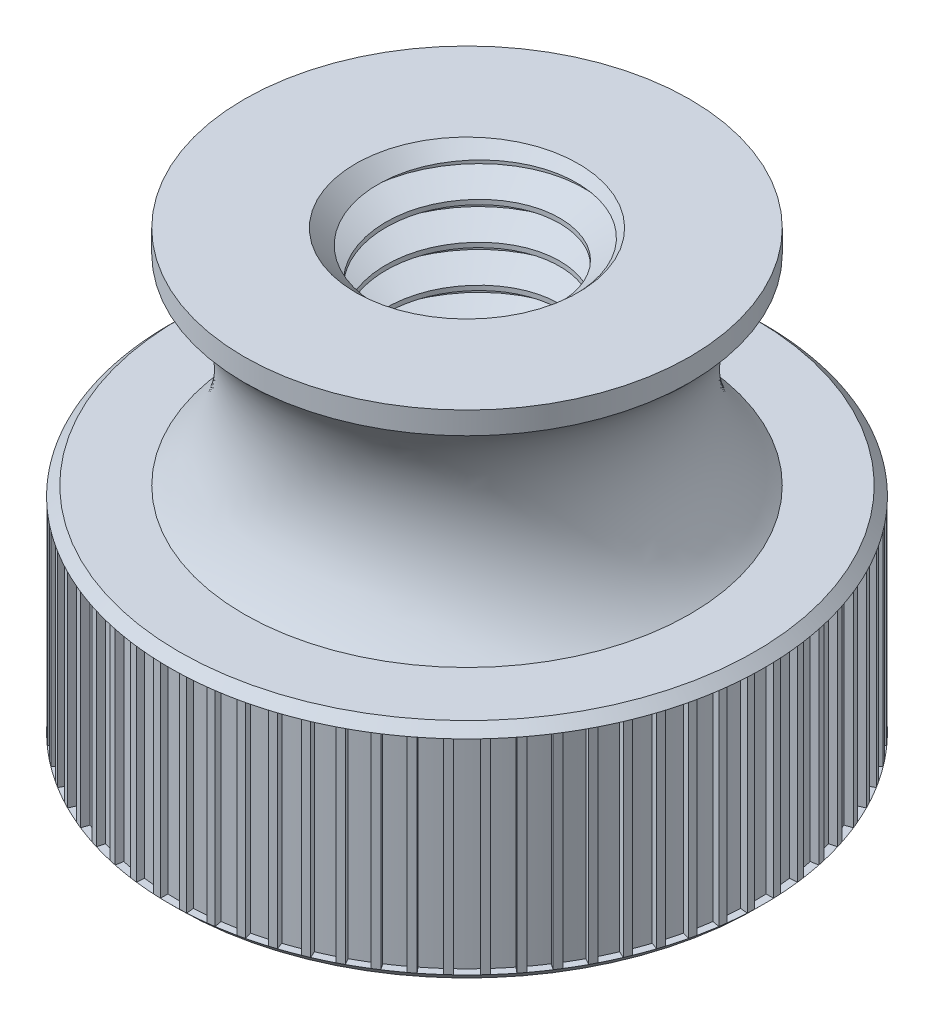
from build123d import *

# Parameters (mm, degrees)
SKETCH3_R               = 1.5
CUT_EXTRUDE1_DEPTH      = 9.246211251
SWEEP1_PITCH            = 0.5
SKETCH13_R              = 4
CUT_EXTRUDE2_DEPTH      = 11.630292617
SKETCH14_R              = 4
CUT_EXTRUDE3_DEPTH      = 9.246211421
CHAMFER1_SIZE           = 0.125
CUT_EXTRUDE6_REACH      = 20.19
CUT_EXTRUDE6_END_RADIUS = 4
SKETCH17_W              = 0.254
SKETCH17_H              = 2.75
CIRPATTERN1_COUNT       = 72


with BuildPart() as part:
    # Sketch1 → Revolve1 (revolve)
    with BuildSketch(Plane.XY, mode=Mode.PRIVATE) as revolve1_sk:
        with BuildLine():
            Line((0, 6), (-3, 6))
            Line((-3, 6), (-3, 5.7))
            ThreePointArc((-3, 5.7), (-2.4, 4.35), (-3, 3))
            Line((-3, 3), (-4, 3))
            Line((-4, 3), (-4, 0))
            Line((-4, 0), (0, 0))
            Line((0, 0), (0, 6))
        make_face()
    revolve(revolve1_sk.sketch.rotate(Axis((0, 0, 0), (0, 1, 0)), 270), axis=Axis((0, 0, 0), (0, 1, 0)))

    # Sketch3 → Cut-Extrude1 (cut, through all)
    with BuildSketch(Plane(origin=(0, 0, 0), x_dir=(1, 0, 0), z_dir=(0, 1, 0))):
        with Locations(Location((0, 0, 0), (0, 0, 270))):
            Circle(SKETCH3_R)
    extrude(amount=CUT_EXTRUDE1_DEPTH, mode=Mode.SUBTRACT)

    # Sweep1: the profile of Sketch5 profile screwed along a left-hand helix of 18 turns, 6 arcs to a turn; built about Z, then put on its axis
    sweep1_z = Axis((0, 0, 0), (0, 0, 1))
    sweep1_corners = [(1.5003, 0, 0.000173205), (1.5003, 0, -0.437673205), (1.175240474, 0, -0.25), (1.175240474, 0, -0.1875)]
    with BuildLine(mode=Mode.PRIVATE) as sweep1_profile:
        Line(sweep1_corners[0], sweep1_corners[1])
        Line(sweep1_corners[1], sweep1_corners[2])
        Line(sweep1_corners[2], sweep1_corners[3])
        Line(sweep1_corners[3], sweep1_corners[0])
    sweep1_cap = Face(sweep1_profile.wire())
    sweep1_turn_angles = [0, -30, -60, -90, -120, -150, -180, -210, -240, -270, -300, -330, -360]
    sweep1_turn_weights = [1, 0.8660254037844387, 1, 0.8660254037844387, 1, 0.8660254037844387, 1, 0.8660254037844387, 1, 0.8660254037844387, 1, 0.8660254037844387, 1]
    sweep1_turn_rails = [Edge.make_bspline([Vector(p[0], p[1], 0).rotate(sweep1_z, sweep1_turn_angles[k]) / sweep1_turn_weights[k] + Vector(0, 0, p[2] + -SWEEP1_PITCH * sweep1_turn_angles[k] / 360) for k in range(13)], [0, 0, 0, 1, 1, 2, 2, 3, 3, 4, 4, 5, 5, 6, 6, 6], 2, sweep1_turn_weights) for p in sweep1_corners]
    sweep1_turn_sides = [Face.make_surface_from_curves(sweep1_turn_rails[p[0]], sweep1_turn_rails[p[1]]) for p in [(0, 1), (1, 2), (2, 3), (3, 0)]]
    sweep1 = Plane(origin=(0, 0, 0), x_dir=(0, 0, 1), z_dir=(0, 1, 0)) * Solid(Shell([*[p.moved(Location((0, 0, SWEEP1_PITCH * i))) for i in range(18) for p in sweep1_turn_sides], sweep1_cap, sweep1_cap.rotate(sweep1_z, -6480).moved(Location((0, 0, -SWEEP1_PITCH * -6480 / 360)))]))
    add(sweep1)

    # Sketch13 → Cut-Extrude2 (cut, through all)
    with BuildSketch(Plane.XZ):
        with Locations(Location((0, 0, 0), (0, 0, 270))):
            Circle(SKETCH13_R)
    extrude(amount=CUT_EXTRUDE2_DEPTH, mode=Mode.SUBTRACT)

    # Sketch14 → Cut-Extrude3 (cut, through all)
    with BuildSketch(Plane(origin=(0, 6, 0), x_dir=(1, 0, 0), z_dir=(0, 1, 0))):
        with Locations(Location((0, 0, 0), (0, 0, 90))):
            Circle(SKETCH14_R)
    extrude(amount=CUT_EXTRUDE3_DEPTH, mode=Mode.SUBTRACT)

    # Cut-Extrude4 cone 1 section (through the dimple's axis) → Cut-Extrude4 (revolve, cut)
    with BuildSketch(Plane(origin=(0, 0, 0), x_dir=(0, 0, -1), z_dir=(1, 0, 0))):
        Polygon((0, 0), (1.5, 0), (0, 1.5), align=None)
    revolve(axis=Axis((0, 0, 0), (0, 1, 0)), mode=Mode.SUBTRACT)

    # Cut-Extrude5 cone 1 section (through the dimple's axis) → Cut-Extrude5 (revolve, cut)
    with BuildSketch(Plane(origin=(0, 6, 0), x_dir=(0, 0, 1), z_dir=(1, 0, 0))):
        Polygon((0, 0), (1.5, 0), (0, 1.5), align=None)
    revolve(axis=Axis((0, 6, 0), (0, -1, 0)), mode=Mode.SUBTRACT)

    # Chamfer1
    chamfer1_edges = [part.edges().sort_by_distance(p)[0] for p in [
        (0, 0, 4),
        (0, 3, 4),
    ]]
    chamfer(chamfer1_edges, length=CHAMFER1_SIZE)

    # Cut-Extrude6: up to this cylinder (the profile starts outside it)
    cut_extrude6_end = Plane(origin=(0, 1.5, 0.1), z_dir=(0, -1, 0)) * Cylinder(CUT_EXTRUDE6_END_RADIUS, 49.38, mode=Mode.PRIVATE)
    # Sketch17 → Cut-Extrude6 (cut, up to the surface)
    with BuildSketch(Plane.XY.offset(-12.7), mode=Mode.PRIVATE) as cut_extrude6_sk1:
        with Locations((0, 1.5)):
            Rectangle(SKETCH17_W, SKETCH17_H)
    cut_extrude6_tool1 = extrude(cut_extrude6_sk1.sketch, amount=CUT_EXTRUDE6_REACH, mode=Mode.PRIVATE) - cut_extrude6_end
    cut_extrude6 = cut_extrude6_tool1.solids().sort_by_distance((0, 1.5, -12.7))[0]
    add(cut_extrude6, mode=Mode.SUBTRACT)

    # CirPattern1: Cut-Extrude6 ×72 about axis
    cirpattern1_axis = Axis((0, 0, 0), (0, 1, 0))
    for i in range(1, CIRPATTERN1_COUNT):
        add(cut_extrude6.rotate(cirpattern1_axis, i * 360 / CIRPATTERN1_COUNT), mode=Mode.SUBTRACT)


solid = part.part
